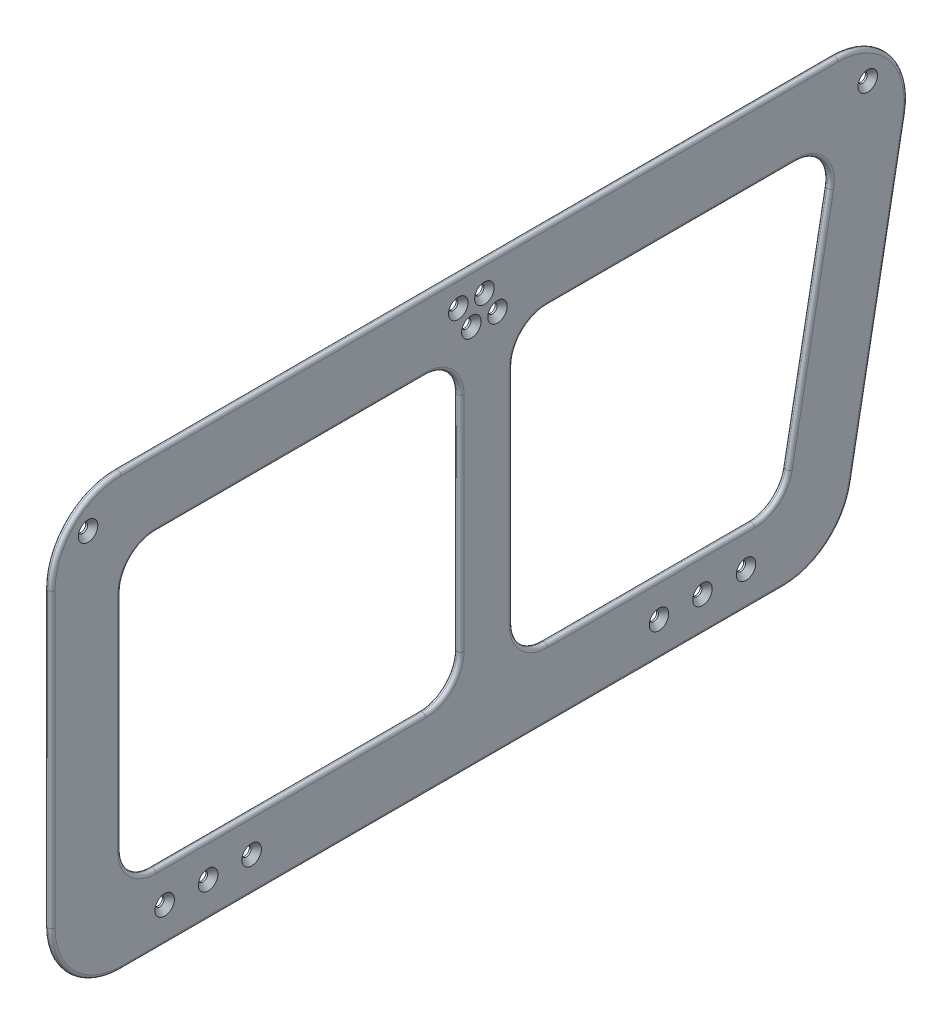
from build123d import *

# Parameters (mm, degrees)
CROQUIS1_W                                    = 195
CROQUIS1_H                                    = 168
SALIENTE_EXTRUIR1_DEPTH                       = 2
REDONDEO1_R                                   = 40
REDONDEO2_R                                   = 20
REFRENTADO_PARA_TORNILLO_TAP_N_CON_C_2_COUNT  = 2
REFRENTADO_PARA_TORNILLO_TAP_N_CON_C_2_PITCH  = 448
REFRENTADO_PARA_TORNILLO_TAP_N_CON_C_3_COUNT  = 2
REFRENTADO_PARA_TORNILLO_TAP_N_CON_C_3_PITCH  = 431.496529335
REFRENTADO_PARA_TORNILLO_TAP_N_CON_C_4_COUNT  = 2
REFRENTADO_PARA_TORNILLO_TAP_N_CON_C_4_PITCH  = 409.770089844
REFRENTADO_PARA_TORNILLO_TAP_N_CON_C_5_COUNT  = 2
REFRENTADO_PARA_TORNILLO_TAP_N_CON_C_5_PITCH  = 388.43763751
REFRENTADO_PARA_TORNILLO_TAP_N_CON_C_6_COUNT  = 2
REFRENTADO_PARA_TORNILLO_TAP_N_CON_C_6_PITCH  = 212.602916255
REFRENTADO_PARA_TORNILLO_TAP_N_CON_C_7_COUNT  = 2
REFRENTADO_PARA_TORNILLO_TAP_N_CON_C_7_PITCH  = 219.146070008
REFRENTADO_PARA_TORNILLO_TAP_N_CON_C_8_COUNT  = 2
REFRENTADO_PARA_TORNILLO_TAP_N_CON_C_8_PITCH  = 228.25424421
REFRENTADO_PARA_TORNILLO_TAP_N_CON_C_9_COUNT  = 2
REFRENTADO_PARA_TORNILLO_TAP_N_CON_C_9_PITCH  = 227.794357344
REFRENTADO_PARA_TORNILLO_TAP_N_CON_C_10_COUNT = 2
REFRENTADO_PARA_TORNILLO_TAP_N_CON_C_10_PITCH = 212.797484097
REFRENTADO_PARA_TORNILLO_TAP_N_CON_C_11_COUNT = 2
REFRENTADO_PARA_TORNILLO_TAP_N_CON_C_11_PITCH = 220.413771716
REFRENTADO_PARA_TORNILLO_TAP_N_CON_C_12_COUNT = 2
REFRENTADO_PARA_TORNILLO_TAP_N_CON_C_12_PITCH = 235.403336344
REDONDEO3_R                                   = 2


with BuildPart() as part:
    # Croquis1 → Saliente-Extruir1 (new, symmetric)
    with BuildSketch(Plane(origin=(0, 0, 0), x_dir=(0, 0, -1), z_dir=(1, 0, 0))):
        Polygon((-250, 0), (-250, 248), (250, 248), (203.83, 0), align=None)
        Polygon((170.589497977, 40), (201.86594959, 208), (15, 208), (15, 40), align=None, mode=Mode.SUBTRACT)
        with Locations((-112.5, 124)):
            Rectangle(CROQUIS1_W, CROQUIS1_H, mode=Mode.SUBTRACT)
    extrude(amount=SALIENTE_EXTRUIR1_DEPTH, both=True)

    # Redondeo1
    redondeo1_edges = [part.edges().sort_by_distance(p)[0] for p in [
        (0, 248, -250),
        (0, 0, -203.83),
        (0, 0, 250),
        (0, 248, 250),
    ]]
    fillet(redondeo1_edges, radius=REDONDEO1_R)

    # Redondeo2
    redondeo2_edges = [part.edges().sort_by_distance(p)[0] for p in [
        (0, 208, 15),
        (0, 208, 210),
        (0, 40, 210),
        (0, 40, 15),
        (0, 208, -201.86594959),
        (0, 208, -15),
        (0, 40, -15),
        (0, 40, -170.589497977),
    ]]
    fillet(redondeo2_edges, radius=REDONDEO2_R)

    # Croquis14 → Refrentado para tornillo tapón con cabeza plana de clavija de M51 (revolve, cut)
    with BuildSketch(Plane(origin=(2, 228, 229), x_dir=(0, 0, -1), z_dir=(0, 1, 0))):
        Polygon((0, 0), (0, 4), (2.65, 4), (2.65, 2.95), (5.6, 0), align=None)
    refrentado_para_tornillo_tap_n_con_cabez = revolve(axis=Axis((8.35, 228, 229), (-1, 0, 0)), mode=Mode.SUBTRACT)

    # Refrentado para tornillo tap_n con c 2: Refrentado para tornillo tapón con cabeza plana de clavija de M51 ×2
    with Locations(*[(0, 0, -i * REFRENTADO_PARA_TORNILLO_TAP_N_CON_C_2_PITCH) for i in range(1, REFRENTADO_PARA_TORNILLO_TAP_N_CON_C_2_COUNT)]):
        add(refrentado_para_tornillo_tap_n_con_cabez, mode=Mode.SUBTRACT)

    # Refrentado para tornillo tap_n con c 3: Refrentado para tornillo tapón con cabeza plana de clavija de M51 ×2
    with Locations(*[Vector(0, -0.4820432746483433, -0.8761474084686333) * (i * REFRENTADO_PARA_TORNILLO_TAP_N_CON_C_3_PITCH) for i in range(1, REFRENTADO_PARA_TORNILLO_TAP_N_CON_C_3_COUNT)]):
        add(refrentado_para_tornillo_tap_n_con_cabez, mode=Mode.SUBTRACT)

    # Refrentado para tornillo tap_n con c 4: Refrentado para tornillo tapón con cabeza plana de clavija de M51 ×2
    with Locations(*[Vector(0, -0.5076017141197064, -0.8615918406198702) * (i * REFRENTADO_PARA_TORNILLO_TAP_N_CON_C_4_PITCH) for i in range(1, REFRENTADO_PARA_TORNILLO_TAP_N_CON_C_4_COUNT)]):
        add(refrentado_para_tornillo_tap_n_con_cabez, mode=Mode.SUBTRACT)

    # Refrentado para tornillo tap_n con c 5: Refrentado para tornillo tapón con cabeza plana de clavija de M51 ×2
    with Locations(*[Vector(0, -0.5354784910482062, -0.8445488651491613) * (i * REFRENTADO_PARA_TORNILLO_TAP_N_CON_C_5_PITCH) for i in range(1, REFRENTADO_PARA_TORNILLO_TAP_N_CON_C_5_COUNT)]):
        add(refrentado_para_tornillo_tap_n_con_cabez, mode=Mode.SUBTRACT)

    # Refrentado para tornillo tap_n con c 6: Refrentado para tornillo tapón con cabeza plana de clavija de M51 ×2
    with Locations(*[Vector(0, -0.9783497031189412, -0.20695859104439157) * (i * REFRENTADO_PARA_TORNILLO_TAP_N_CON_C_6_PITCH) for i in range(1, REFRENTADO_PARA_TORNILLO_TAP_N_CON_C_6_COUNT)]):
        add(refrentado_para_tornillo_tap_n_con_cabez, mode=Mode.SUBTRACT)

    # Refrentado para tornillo tap_n con c 7: Refrentado para tornillo tapón con cabeza plana de clavija de M51 ×2
    with Locations(*[Vector(0, -0.9491386270002529, -0.3148584868414302) * (i * REFRENTADO_PARA_TORNILLO_TAP_N_CON_C_7_PITCH) for i in range(1, REFRENTADO_PARA_TORNILLO_TAP_N_CON_C_7_COUNT)]):
        add(refrentado_para_tornillo_tap_n_con_cabez, mode=Mode.SUBTRACT)

    # Refrentado para tornillo tap_n con c 8: Refrentado para tornillo tapón con cabeza plana de clavija de M51 ×2
    with Locations(*[Vector(0, -0.9112645450237129, -0.4118214770780242) * (i * REFRENTADO_PARA_TORNILLO_TAP_N_CON_C_8_PITCH) for i in range(1, REFRENTADO_PARA_TORNILLO_TAP_N_CON_C_8_COUNT)]):
        add(refrentado_para_tornillo_tap_n_con_cabez, mode=Mode.SUBTRACT)

    # Refrentado para tornillo tap_n con c 9: Refrentado para tornillo tapón con cabeza plana de clavija de M51 ×2
    with Locations(*[Vector(0, 0.019733546435435883, -0.9998052746135522) * (i * REFRENTADO_PARA_TORNILLO_TAP_N_CON_C_9_PITCH) for i in range(1, REFRENTADO_PARA_TORNILLO_TAP_N_CON_C_9_COUNT)]):
        add(refrentado_para_tornillo_tap_n_con_cabez, mode=Mode.SUBTRACT)

    # Refrentado para tornillo tap_n con c 10: Refrentado para tornillo tapón con cabeza plana de clavija de M51 ×2
    with Locations(*[Vector(0, 0.021124265390001246, -0.9997768578096479) * (i * REFRENTADO_PARA_TORNILLO_TAP_N_CON_C_10_PITCH) for i in range(1, REFRENTADO_PARA_TORNILLO_TAP_N_CON_C_10_COUNT)]):
        add(refrentado_para_tornillo_tap_n_con_cabez, mode=Mode.SUBTRACT)

    # Refrentado para tornillo tap_n con c 11: Refrentado para tornillo tapón con cabeza plana de clavija de M51 ×2
    with Locations(*[Vector(0, -0.03854201333356631, -0.9992569805651573) * (i * REFRENTADO_PARA_TORNILLO_TAP_N_CON_C_11_PITCH) for i in range(1, REFRENTADO_PARA_TORNILLO_TAP_N_CON_C_11_COUNT)]):
        add(refrentado_para_tornillo_tap_n_con_cabez, mode=Mode.SUBTRACT)

    # Refrentado para tornillo tap_n con c 12: Refrentado para tornillo tapón con cabeza plana de clavija de M51 ×2
    with Locations(*[Vector(0, -0.03608780852600862, -0.9993486228918266) * (i * REFRENTADO_PARA_TORNILLO_TAP_N_CON_C_12_PITCH) for i in range(1, REFRENTADO_PARA_TORNILLO_TAP_N_CON_C_12_COUNT)]):
        add(refrentado_para_tornillo_tap_n_con_cabez, mode=Mode.SUBTRACT)

    # Redondeo3
    redondeo3_edges = [part.edges().sort_by_distance(p)[0] for p in [
        (-2, 45.857864376, -20.857864376),
        (-2, 124, -15),
        (-2, 202.142135624, -20.857864376),
        (-2, 208, -106.399462193),
        (-2, 200.782608163, -193.180892028),
        (-2, 120.339507145, -185.546252191),
        (-2, 44.618032358, -166.751855129),
        (-2, 45.857864376, 204.142135624),
        (-2, 124, 210),
        (-2, 202.142135624, 204.142135624),
        (-2, 208, 112.5),
        (-2, 202.142135624, 20.857864376),
        (-2, 124, 15),
        (-2, 45.857864376, 20.857864376),
        (2, 45.857864376, -20.857864376),
        (2, 124, -15),
        (2, 202.142135624, -20.857864376),
        (2, 208, -106.399462193),
        (2, 200.782608163, -193.180892028),
        (2, 120.339507145, -185.546252191),
        (2, 44.618032358, -166.751855129),
        (2, 202.142135624, 20.857864376),
        (2, 124, 15),
        (2, 45.857864376, 20.857864376),
        (2, 40, 112.5),
        (2, 45.857864376, 204.142135624),
        (2, 124, 210),
        (2, 202.142135624, 204.142135624),
        (-2, 40, -94.484623483),
        (-2, 40, 112.5),
        (2, 40, -94.484623483),
        (2, 208, 112.5),
        (-2, 233.565216326, -232.629884875),
        (-2, 116.67901429, -225.552056814),
        (-2, 9.236064715, -196.154714304),
        (-2, 0, 19.705251011),
        (-2, 11.715728753, 238.284271247),
        (-2, 124, 250),
        (-2, 236.284271247, 238.284271247),
        (2, 233.565216326, -232.629884875),
        (2, 116.67901429, -225.552056814),
        (2, 9.236064715, -196.154714304),
        (2, 0, 19.705251011),
        (2, 11.715728753, 238.284271247),
        (2, 124, 250),
        (2, 236.284271247, 238.284271247),
        (-2, 248, 4.067025205),
        (2, 248, 4.067025205),
    ]]
    fillet(redondeo3_edges, radius=REDONDEO3_R - 0.0001)  # a hair under: the kernel refuses the full size


solid = part.part
